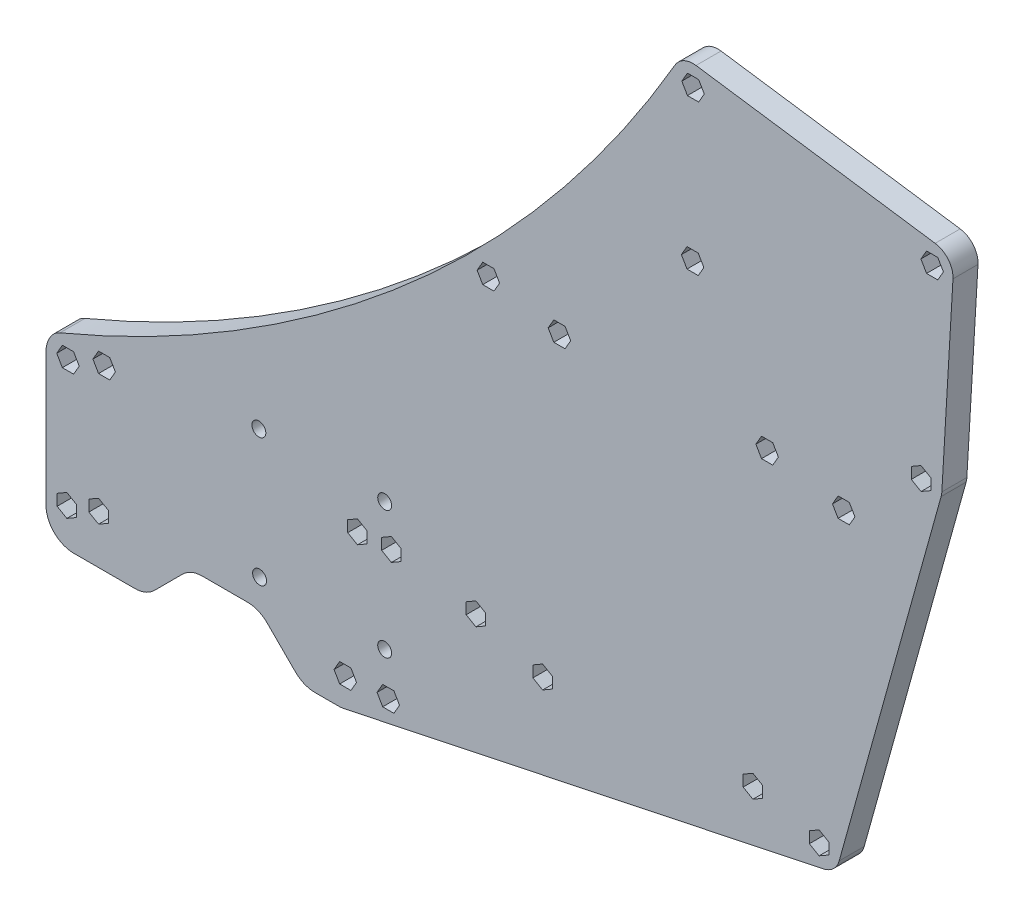
from build123d import *

# Parameters (mm, degrees)
SKETCH2_R           = 2.499965
SKETCH2_R_2         = 2.49997
SKETCH2_R_3         = 2.4999655
SKETCH2_R_4         = 2.499962807
SKETCH2_R_5         = 2.4999705
SKETCH2_R_6         = 2.499967809
SKETCH2_R_7         = 2.499966
SKETCH2_R_8         = 2.4999665
SKETCH2_R_9         = 2.499966488
BOSS_EXTRUDE1_DEPTH = 9
CUT_EXTRUDE1_DEPTH  = 10
CUT_EXTRUDE2_DEPTH  = 244.998875453
SKETCH5_R           = 2.5
CUT_EXTRUDE3_DEPTH  = 244.998875453
CUT_EXTRUDE5_DEPTH  = 10
FILLET1_R           = 10
CUT_EXTRUDE6_DEPTH  = 244.998875453


with BuildPart() as part:
    # Sketch2 → Boss-Extrude1 (new body)
    with BuildSketch(Plane.XY):
        Polygon((-211.70586, -139.55845), (122.983766, -139.55845), (211.70583, 139.558464), (-211.70586, 139.558464), align=None)
        with Locations((-192.444718, -125.900476)):
            Circle(SKETCH2_R, mode=Mode.SUBTRACT)
        with Locations((-181.028235, -121.988219)):
            Circle(SKETCH2_R_2, mode=Mode.SUBTRACT)
        with Locations((-192.0409685, -80.3042345)):
            Circle(SKETCH2_R_3, mode=Mode.SUBTRACT)
        with Locations((-179.0281635, -75.623296193)):
            Circle(SKETCH2_R_4, mode=Mode.SUBTRACT)
        with Locations((-92.3000565, -128.9494755)):
            Circle(SKETCH2_R_5, mode=Mode.SUBTRACT)
        with Locations((-76.832143809, -128.336904809)):
            Circle(SKETCH2_R_6, mode=Mode.SUBTRACT)
        with Locations((-87.928392809, -81.863553809)):
            Circle(SKETCH2_R_6, mode=Mode.SUBTRACT)
        with Locations((-75.718345809, -81.250965809)):
            Circle(SKETCH2_R_6, mode=Mode.SUBTRACT)
        with Locations((-45.325502, -86.123854)):
            Circle(SKETCH2_R, mode=Mode.SUBTRACT)
        with Locations((-21.323083, -93.781229)):
            Circle(SKETCH2_R_7, mode=Mode.SUBTRACT)
        with Locations((54.304011, -89.994307)):
            Circle(SKETCH2_R_7, mode=Mode.SUBTRACT)
        with Locations((78.1115035, -95.7303835)):
            Circle(SKETCH2_R_8, mode=Mode.SUBTRACT)
        with Locations((114.776659, 36.09363)):
            Circle(SKETCH2_R, mode=Mode.SUBTRACT)
        with Locations((86.96623, 12.266557)):
            Circle(SKETCH2_R_7, mode=Mode.SUBTRACT)
        with Locations((59.4275, 17.097677)):
            Circle(SKETCH2_R, mode=Mode.SUBTRACT)
        with Locations((-40.842451, 21.163049)):
            Circle(SKETCH2_R, mode=Mode.SUBTRACT)
        with Locations((-15.2807135, 15.9838705)):
            Circle(SKETCH2_R_8, mode=Mode.SUBTRACT)
        with Locations((32.626661, 62.749598)):
            Circle(SKETCH2_R_7, mode=Mode.SUBTRACT)
        with Locations((118.780878488, 104.469667)):
            Circle(SKETCH2_R_9, mode=Mode.SUBTRACT)
        with Locations((32.7798015, 116.8664005)):
            Circle(SKETCH2_R_8, mode=Mode.SUBTRACT)
    extrude(amount=BOSS_EXTRUDE1_DEPTH)

    # Sketch3 → Cut-Extrude1 (cut)
    with BuildSketch(Plane.XY.offset(9)):
        Polygon((147.113293383, 124.3664005), (73.705987484, -139.55845), (211.70583, -139.55845), (211.70583, 139.558464), (-211.70586, 139.558464), (-211.70586, -139.55845), (-199.944718, -139.55845), (-199.944718, -77.260214262), (29.956914073, 124.3664005), align=None)
    extrude(amount=-CUT_EXTRUDE1_DEPTH, mode=Mode.SUBTRACT)

    # Sketch4 → Cut-Extrude2 (cut, through all)
    with BuildSketch(Plane.XY.offset(9)):
        Polygon((-163.885127, -139.55845), (-147.880898, -123.554221), (-123.333708966, -123.554221), (-107.329479966, -139.55845), align=None)
    extrude(amount=-CUT_EXTRUDE2_DEPTH, mode=Mode.SUBTRACT)

    # Sketch5 → Cut-Extrude3 (cut, through all)
    with BuildSketch(Plane.XY.offset(9)):
        with Locations((-123.130898, -113.554221)):
            Circle(SKETCH5_R)
        with Locations((-78.130898, -113.554221)):
            Circle(SKETCH5_R)
        with Locations((-123.380898, -67.554221)):
            Circle(SKETCH5_R)
        with Locations((-78.130898, -67.554221)):
            Circle(SKETCH5_R)
    extrude(amount=-CUT_EXTRUDE3_DEPTH, mode=Mode.SUBTRACT)

    # Sketch6 → Cut-Extrude5 (cut)
    with BuildSketch(Plane.XY.offset(9)):
        with BuildLine():
            Line((-195.525508542, -73.384512142), (-194.933621691, -73.384512142))
            ThreePointArc((-194.933621691, -73.384512142), (-115.656074248, -30.741284252), (-46.149790694, 26.462307945))
            ThreePointArc((-46.149790694, 26.462307945), (-6.887258575, 71.211725192), (26.296691523, 120.637247226))
            Line((26.296691523, 120.637247226), (26.296691523, 121.156339417))
            Line((26.296691523, 121.156339417), (-195.525508542, -73.384512142))
        make_face()
        Polygon((147.113293383, 35.655168177), (147.113293383, 124.3664005), (122.439403996, 35.655168177), align=None)
        Polygon((-75.287663516, -135.676154132), (-93.736030822, -139.55845), (73.705987484, -139.55845), (83.854883116, -103.069632849), (79.655983667, -103.069632849), align=None)
        with BuildLine():
            Line((79.655983667, -103.069632849), (83.854883116, -103.069632849))
            Line((83.854883116, -103.069632849), (85.337218021, -97.740122205))
            ThreePointArc((85.337218021, -97.740122205), (83.24278011, -101.200301265), (79.655983667, -103.069632849))
        make_face()
        with BuildLine():
            ThreePointArc((-196.986177186, -74.665536862), (-196.011897332, -73.941709513), (-194.933621691, -73.384512142))
            Line((-194.933621691, -73.384512142), (-195.525508542, -73.384512142))
            Line((-195.525508542, -73.384512142), (-196.986177186, -74.665536862))
        make_face()
        Polygon((26.296691523, 124.3664005), (26.296691523, 121.156339417), (27.834592626, 122.505097973), (29.956914073, 124.3664005), align=None)
        with BuildLine():
            Line((27.834592626, 122.505097973), (26.296691523, 121.156339417))
            Line((26.296691523, 121.156339417), (26.296691523, 120.637247226))
            ThreePointArc((26.296691523, 120.637247226), (26.989824424, 121.633597313), (27.834592626, 122.505097973))
        make_face()
        with BuildLine():
            Line((29.956914073, 124.3664005), (27.834592626, 122.505097973))
            ThreePointArc((27.834592626, 122.505097973), (30.137854408, 123.885667952), (32.779801516, 124.3664005))
            Line((32.779801516, 124.3664005), (29.956914073, 124.3664005))
        make_face()
        with BuildLine():
            Line((147.113293383, 124.3664005), (32.779801516, 124.3664005))
            ThreePointArc((32.779801516, 124.3664005), (33.31619378, 124.347194798), (33.849838899, 124.289676055))
            Line((33.849838899, 124.289676055), (119.850915887, 111.892942555))
            ThreePointArc((119.850915887, 111.892942555), (124.449885477, 109.380100764), (126.280878488, 104.469667))
            ThreePointArc((126.280878488, 104.469667), (126.277670913, 104.250342289), (126.268050933, 104.031205177))
            Line((126.268050933, 104.031205177), (122.263831446, 35.655168177))
            Line((122.263831446, 35.655168177), (122.439403996, 35.655168177))
            Line((122.439403996, 35.655168177), (147.113293383, 124.3664005))
        make_face()
        with BuildLine():
            Line((122.002373456, 34.083891063), (122.439403996, 35.655168177))
            Line((122.439403996, 35.655168177), (122.263831446, 35.655168177))
            ThreePointArc((122.263831446, 35.655168177), (122.174935028, 34.862568747), (122.002373456, 34.083891063))
        make_face()
    extrude(amount=-CUT_EXTRUDE5_DEPTH, mode=Mode.SUBTRACT)

    # Fillet1
    # the kernel refuses this fillet: 10 mm, written as the material it adds along each edge
    with BuildSketch(Plane(origin=(-147.880898, -123.554221, 9), x_dir=(1, 0, 0), z_dir=(0, 0, -1)), Plane(origin=(-123.333708966, -123.554221, 9), x_dir=(0.707106781186551, -0.7071067811865441, 0), z_dir=(0, 0, -1))) as fillet1_piece_1:
        with BuildLine():
            CenterArc((FILLET1_R * 0.414213562373, FILLET1_R), FILLET1_R, 225, 45)
            Line((-FILLET1_R * 0.292893218813, FILLET1_R * 0.292893218813), (0, 0))
            Line((0, 0), (FILLET1_R * 0.414213562373, 0))
        make_face()
    extrude(amount=9)
    # the kernel refuses this fillet: 10 mm, written as the material it takes off along each edge
    with BuildSketch(Plane(origin=(-199.944718, -77.260214262, 20.264688934), x_dir=(0, -1, 0), z_dir=(0, 0, -1))) as fillet1_2_piece_1:
        with BuildLine():
            CenterArc((4.505875574, -10), FILLET1_R, 90, 45.239414653)
            Line((-2.5946774, -2.958540814), (0, 0))
            Line((0, 0), (4.505875574, 0))
        make_face()
    extrude(amount=31.529377868, mode=Mode.SUBTRACT)
    with BuildSketch(Plane(origin=(-163.885127, -139.55845, 19.355339059), x_dir=(-1, 0, 0), z_dir=(0, 0, -1)), Plane(origin=(-107.329479966, -139.55845, 19.355339059), x_dir=(-0.707106781186551, 0.7071067811865441, 0), z_dir=(0, 0, -1))) as fillet1_2_piece_2:
        with BuildLine():
            CenterArc((FILLET1_R * 0.414213562373, FILLET1_R), FILLET1_R, 225, 45)
            Line((-FILLET1_R * 0.292893218813, FILLET1_R * 0.292893218813), (0, 0))
            Line((0, 0), (FILLET1_R * 0.414213562373, 0))
        make_face()
    extrude(amount=29.710678119, mode=Mode.SUBTRACT)
    with BuildSketch(Plane(origin=(-93.736030822, -139.55845, 11.602018692), x_dir=(-1, 0, 0), z_dir=(0, 0, -1))) as fillet1_2_piece_3:
        with BuildLine():
            CenterArc((FILLET1_R * 0.104080747675, FILLET1_R), FILLET1_R, 258.116013885, 11.883986115)
            Line((-FILLET1_R * 0.101849941288, FILLET1_R * 0.0214334200765), (0, 0))
            Line((0, 0), (FILLET1_R * 0.104080747675, 0))
        make_face()
    extrude(amount=14.204037384, mode=Mode.SUBTRACT)
    with BuildSketch(Plane(origin=(-199.944718, -139.55845, 34), x_dir=(1, 0, 0), z_dir=(0, 0, -1))) as fillet1_2_piece_4:
        with BuildLine():
            CenterArc((FILLET1_R, -FILLET1_R), FILLET1_R, 90, 90)
            Line((0, -FILLET1_R), (0, 0))
            Line((0, 0), (FILLET1_R, 0))
        make_face()
    extrude(amount=59, mode=Mode.SUBTRACT)

    # Sketch7 → Cut-Extrude6 (cut, through all)
    with BuildSketch(Plane.XY):
        Polygon((-190.020242558, -83.8042345), (-187.999516616, -80.3042345), (-190.020242558, -76.8042345), (-194.061694442, -76.8042345), (-196.082420384, -80.3042345), (-194.061694442, -83.8042345), align=None)
        Polygon((-181.048889442, -79.123296193), (-177.007437558, -79.123296193), (-174.986711616, -75.623296193), (-177.007437558, -72.123296193), (-181.048889442, -72.123296193), (-183.069615384, -75.623296193), align=None)
        Polygon((-192.444718, -129.941927884), (-188.944718, -127.921201942), (-188.944718, -123.879750058), (-192.444718, -121.859024116), (-195.944718, -123.879750058), (-195.944718, -127.921201942), align=None)
        Polygon((-177.528235, -124.008944942), (-177.528235, -119.967493058), (-181.028235, -117.946767116), (-184.528235, -119.967493058), (-184.528235, -124.008944942), (-181.028235, -126.029670884), align=None)
        Polygon((-96.341508384, -128.9494755), (-94.320782442, -132.4494755), (-90.279330558, -132.4494755), (-88.258604616, -128.9494755), (-90.279330558, -125.4494755), (-94.320782442, -125.4494755), align=None)
        Polygon((-80.873595694, -128.336904809), (-78.852869751, -131.836904809), (-74.811417867, -131.836904809), (-72.790691925, -128.336904809), (-74.811417867, -124.836904809), (-78.852869751, -124.836904809), align=None)
        Polygon((-91.428392809, -83.884279751), (-87.928392809, -85.905005694), (-84.428392809, -83.884279751), (-84.428392809, -79.842827867), (-87.928392809, -77.822101925), (-91.428392809, -79.842827867), align=None)
        Polygon((-72.218345809, -83.271691751), (-72.218345809, -79.230239867), (-75.718345809, -77.209513925), (-79.218345809, -79.230239867), (-79.218345809, -83.271691751), (-75.718345809, -85.292417694), align=None)
        Polygon((-45.325502, -90.165305884), (-41.825502, -88.144579942), (-41.825502, -84.103128058), (-45.325502, -82.082402116), (-48.825502, -84.103128058), (-48.825502, -88.144579942), align=None)
        Polygon((-21.323083, -97.822680884), (-17.823083, -95.801954942), (-17.823083, -91.760503058), (-21.323083, -89.739777116), (-24.823083, -91.760503058), (-24.823083, -95.801954942), align=None)
        Polygon((50.804011, -92.015032942), (54.304011, -94.035758884), (57.804011, -92.015032942), (57.804011, -87.973581058), (54.304011, -85.952855116), (50.804011, -87.973581058), align=None)
        Polygon((74.6115035, -97.751109442), (78.1115035, -99.771835384), (81.6115035, -97.751109442), (81.6115035, -93.709657558), (78.1115035, -91.688931616), (74.6115035, -93.709657558), align=None)
        Polygon((-38.821725058, 17.663049), (-36.800999116, 21.163049), (-38.821725058, 24.663049), (-42.863176942, 24.663049), (-44.883902884, 21.163049), (-42.863176942, 17.663049), align=None)
        Polygon((-11.239261616, 15.9838705), (-13.259987558, 19.4838705), (-17.301439442, 19.4838705), (-19.322165384, 15.9838705), (-17.301439442, 12.4838705), (-13.259987558, 12.4838705), align=None)
        Polygon((61.448225942, 13.597677), (63.468951884, 17.097677), (61.448225942, 20.597677), (57.406774058, 20.597677), (55.386048116, 17.097677), (57.406774058, 13.597677), align=None)
        Polygon((84.945504058, 8.766557), (88.986955942, 8.766557), (91.007681884, 12.266557), (88.986955942, 15.766557), (84.945504058, 15.766557), (82.924778116, 12.266557), align=None)
        Polygon((114.776659, 32.052178116), (118.276659, 34.072904058), (118.276659, 38.114355942), (114.776659, 40.135081884), (111.276659, 38.114355942), (111.276659, 34.072904058), align=None)
        Polygon((34.647386942, 59.249598), (36.668112884, 62.749598), (34.647386942, 66.249598), (30.605935058, 66.249598), (28.585209116, 62.749598), (30.605935058, 59.249598), align=None)
        Polygon((34.800527442, 113.3664005), (36.821253384, 116.8664005), (34.800527442, 120.3664005), (30.759075558, 120.3664005), (28.738349616, 116.8664005), (30.759075558, 113.3664005), align=None)
        Polygon((116.760152546, 100.969667), (120.80160443, 100.969667), (122.822330372, 104.469667), (120.80160443, 107.969667), (116.760152546, 107.969667), (114.739426603, 104.469667), align=None)
    extrude(amount=CUT_EXTRUDE6_DEPTH, mode=Mode.SUBTRACT)


solid = part.part
